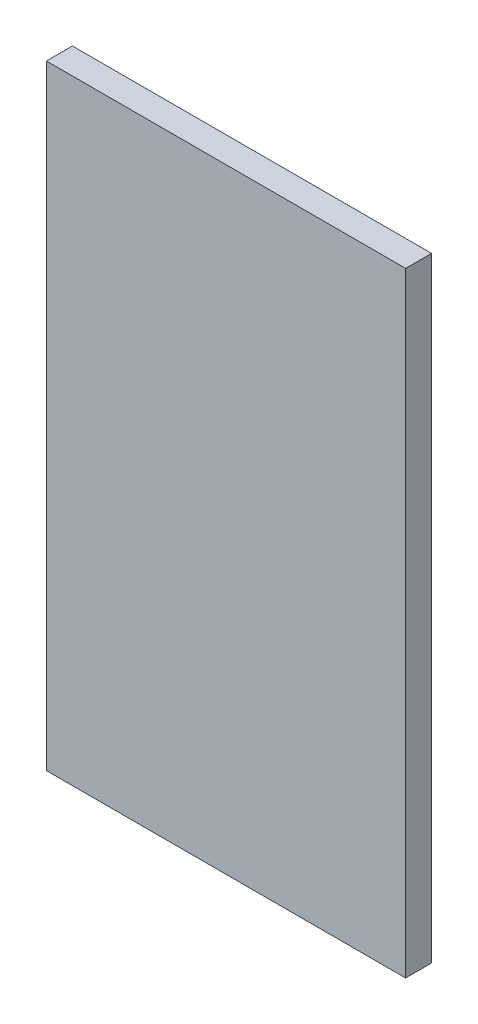
from build123d import *

# Parameters (mm, degrees)
SKETCH3_W           = 166
SKETCH3_H           = 284
BOSS_EXTRUDE2_DEPTH = 12


with BuildPart() as part:
    # Sketch3 → Boss-Extrude2 (new body)
    with BuildSketch(Plane.XY):
        with Locations((500, 72)):
            Rectangle(SKETCH3_W, SKETCH3_H)
    extrude(amount=BOSS_EXTRUDE2_DEPTH)


solid = part.part
